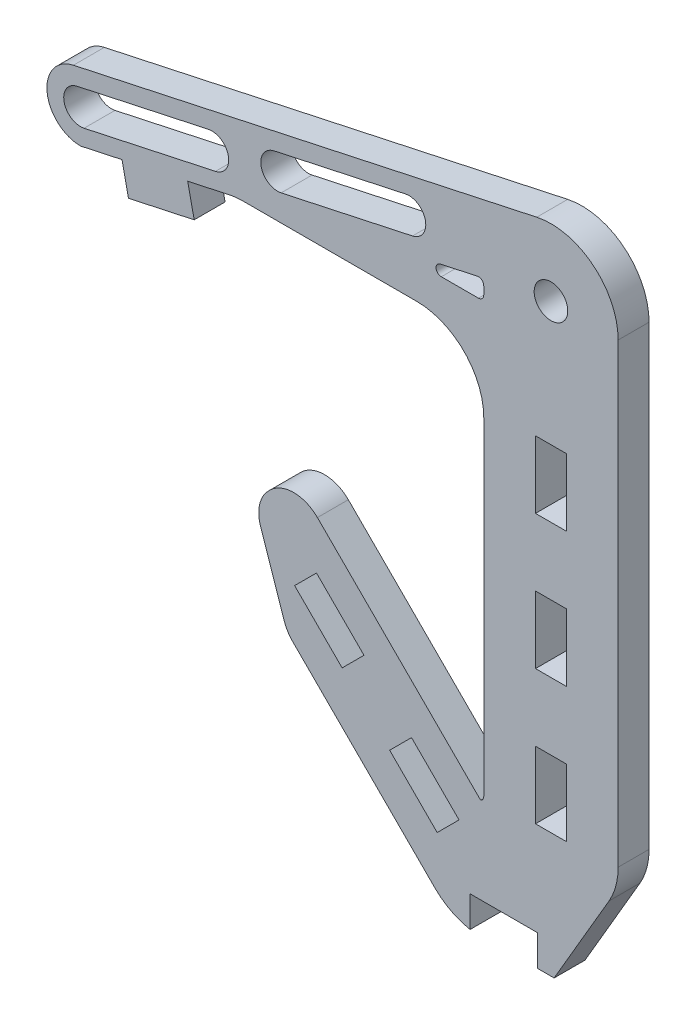
from build123d import *

# Parameters (mm, degrees)
SKETCH1_R           = 3.175
SKETCH1_W           = 5.842
SKETCH1_H           = 12.7
BOSS_EXTRUDE1_DEPTH = 5.842
FILLET3_R           = 12.7
FILLET4_R           = 1
FILLET5_R           = 1
BOSS_EXTRUDE2_DEPTH = 5.842
CUT_EXTRUDE1_DEPTH  = 282.950775489
FILLET6_R           = 6.35
BOSS_EXTRUDE3_DEPTH = 5.842


with BuildPart() as part:
    # Sketch1 → Boss-Extrude1 (new body)
    with BuildSketch(Plane.XY):
        with BuildLine():
            Line((217.770203729, 9.126532246), (220.945203729, 9.126532246))
            Line((220.945203729, 9.126532246), (220.945203729, 14.968532246))
            Line((220.945203729, 14.968532246), (233.645203729, 14.968532246))
            Line((233.645203729, 14.968532246), (233.645203729, 9.126532246))
            Line((233.645203729, 9.126532246), (236.820203729, 9.126532246))
            Line((236.820203729, 9.126532246), (248.922907622, 29.883396652))
            Line((248.922907622, 29.883396652), (248.922907622, 36.233396652))
            Line((248.922907622, 36.233396652), (248.922907622, 99.733396652))
            Line((248.922907622, 99.733396652), (248.922907622, 119.585663985))
            ThreePointArc((248.922907622, 119.585663985), (244.199339956, 129.46830165), (233.542352153, 131.99955227))
            Line((233.542352153, 131.99955227), (145.982629888, 113.092608128))
            ThreePointArc((145.982629888, 113.092608128), (141.008772871, 106.211718626), (147.322907622, 100.535663985))
            Line((147.322907622, 100.535663985), (176.730316466, 106.885663985))
            Line((176.730316466, 106.885663985), (223.522907622, 106.885663985))
            Line((223.522907622, 106.885663985), (223.522907622, 30.685663985))
            Line((223.522907622, 30.685663985), (222.929875834, 31.278695773))
            Line((222.929875834, 31.278695773), (218.798958018, 27.147777957))
            Line((218.798958018, 27.147777957), (209.818701897, 36.128034078))
            Line((209.818701897, 36.128034078), (213.949619713, 40.258951894))
            Line((213.949619713, 40.258951894), (204.969363592, 49.239208015))
            Line((204.969363592, 49.239208015), (200.838445776, 45.108290199))
            Line((200.838445776, 45.108290199), (187.961093383, 57.985642593))
            Line((187.961093383, 57.985642593), (192.092011199, 62.116560408))
            Line((192.092011199, 62.116560408), (187.601883138, 66.606688469))
            Line((187.601883138, 66.606688469), (180.072011297, 59.076816628))
            Line((180.072011297, 59.076816628), (186.339307306, 40.55742867))
            Line((186.339307306, 40.55742867), (190.829435366, 36.067300609))
            Line((190.829435366, 36.067300609), (217.770203729, 9.126532246))
        make_face()
        with Locations((236.222907622, 119.585663985)):
            Circle(SKETCH1_R, mode=Mode.SUBTRACT)
        Polygon((223.522907622, 116.989680814), (223.522907622, 113.235663985), (206.137725309, 113.235663985), align=None, mode=Mode.SUBTRACT)
        with BuildLine():
            Line((146.652768755, 109.989136056), (171.480545327, 115.350246995))
            ThreePointArc((171.480545327, 115.350246995), (175.254156266, 112.916913791), (172.820823062, 109.143302852))
            Line((172.820823062, 109.143302852), (147.99304649, 103.782191913))
            ThreePointArc((147.99304649, 103.782191913), (144.219435551, 106.215525117), (146.652768755, 109.989136056))
        make_face(mode=Mode.SUBTRACT)
        with BuildLine():
            Line((183.894433613, 118.030802464), (208.722210185, 123.391913403))
            ThreePointArc((208.722210185, 123.391913403), (212.495821124, 120.958580199), (210.062487919, 117.18496926))
            Line((210.062487919, 117.18496926), (185.234711348, 111.823858321))
            ThreePointArc((185.234711348, 111.823858321), (181.461100409, 114.257191525), (183.894433613, 118.030802464))
        make_face(mode=Mode.SUBTRACT)
        with Locations((236.222907622, 38.956098115)):
            Rectangle(SKETCH1_W, SKETCH1_H, mode=Mode.SUBTRACT)
        with Locations((236.222907622, 64.356098115)):
            Rectangle(SKETCH1_W, SKETCH1_H, mode=Mode.SUBTRACT)
        with Locations((236.222907622, 89.756098115)):
            Rectangle(SKETCH1_W, SKETCH1_H, mode=Mode.SUBTRACT)
    extrude(amount=BOSS_EXTRUDE1_DEPTH)

    # Fillet3
    # the kernel refuses this fillet: 12.7 mm, written as the material it adds along each edge
    with BuildSketch(Plane(origin=(223.522907622, 106.885663985, 0), x_dir=(0, -1, 0), z_dir=(0, 0, 1))) as fillet3_piece_1:
        with BuildLine():
            CenterArc((FILLET3_R, -FILLET3_R), FILLET3_R, 90, 90)
            Line((0, -FILLET3_R), (0, 0))
            Line((0, 0), (FILLET3_R, 0))
        make_face()
    extrude(amount=5.842)
    with BuildSketch(Plane(origin=(176.730316466, 106.885663985, 0), x_dir=(1, 0, 0), z_dir=(0, 0, 1))) as fillet3_piece_2:
        with BuildLine():
            CenterArc((FILLET3_R * 0.106735979666, -FILLET3_R), FILLET3_R, 90, 12.184909582)
            Line((-FILLET3_R * 0.104331380131, -FILLET3_R * 0.0225284814234), (0, 0))
            Line((0, 0), (FILLET3_R * 0.106735979666, 0))
        make_face()
    extrude(amount=5.842)
    # the kernel refuses this fillet: 12.7 mm, written as the material it takes off along each edge
    with BuildSketch(Plane(origin=(248.922907622, 29.883396652, -8.580237273), x_dir=(-0.50370125175659, -0.8638779132370756, 0), z_dir=(0, 0, 1))) as fillet3_2_piece_1:
        with BuildLine():
            CenterArc((FILLET3_R * 0.270243693634, -FILLET3_R), FILLET3_R, 90, 30.245176455)
            Line((-FILLET3_R * 0.233457558122, -FILLET3_R * 0.136122086763), (0, 0))
            Line((0, 0), (FILLET3_R * 0.270243693634, 0))
        make_face()
    extrude(amount=23.002474546, mode=Mode.SUBTRACT)
    with BuildSketch(Plane(origin=(217.770203729, 9.126532246, -12.412377003), x_dir=(1, 0, 0), z_dir=(0, 0, 1))) as fillet3_2_piece_2:
        with BuildLine():
            CenterArc((5.469505741, 12.491006501), FILLET3_R, 225, 34.591227114)
            Line((-3.51075038, 3.51075038), (0, 0))
            Line((0, 0), (3.175, 0))
        make_face()
    extrude(amount=30.666754006, mode=Mode.SUBTRACT)

    # Fillet4
    fillet4_edges = [part.edges().sort_by_distance(p)[0] for p in [
        (223.522907622, 116.989680814, 2.921),
        (206.137725309, 113.235663985, 2.921),
        (223.522907622, 113.235663985, 2.921),
    ]]
    fillet(fillet4_edges, radius=FILLET4_R)

    # Fillet5
    # the kernel refuses this fillet: 1 mm, written as the material it adds along each edge
    with BuildSketch(Plane(origin=(223.522907622, 30.685663985, 0), x_dir=(0, 1, 0), z_dir=(0, 0, 1))) as fillet5_piece_1:
        with BuildLine():
            CenterArc((1.50647411, 1), FILLET5_R, 204.01452435, 65.98547565)
            Line((0.593031788, 0.593031788), (0.574762942, 0.584892424))
            ThreePointArc((0.574762942, 0.584892424), (0.282373759, 0.31065803), (-0.014142136, 0.014142136))
            Line((-0.014142136, 0.014142136), (0, -0.02))
            Line((0, -0.02), (1.50647411, -0.02))
            Line((1.50647411, -0.02), (1.50647411, 0))
        make_face()
    extrude(amount=5.842)

    # Sketch4 → Boss-Extrude2 (add)
    with BuildSketch(Plane.XY.offset(5.842)):
        Polygon((192.092011199, 62.116560408), (222.590849502, 31.617722105), (222.929875834, 31.278695773), (218.798958018, 27.147777957), (187.961093383, 57.985642593), align=None)
    extrude(amount=-BOSS_EXTRUDE2_DEPTH)

    # Sketch5 → Cut-Extrude1 (cut, through all)
    with BuildSketch(Plane.XY.offset(5.842)):
        Polygon((191.912406076, 52.956699165), (187.781488261, 48.825781349), (196.761744382, 39.845525228), (200.892662197, 43.976443044), align=None)
        Polygon((209.872918318, 34.996186923), (205.742000503, 30.865269107), (214.722256624, 21.885012986), (218.85317444, 26.015930802), align=None)
    extrude(amount=-CUT_EXTRUDE1_DEPTH, mode=Mode.SUBTRACT)

    # Fillet6
    fillet6_edges = [part.edges().sort_by_distance(p)[0] for p in [
        (186.339307306, 40.55742867, 2.921),
        (180.072011297, 59.076816628, 2.921),
        (187.601883138, 66.606688469, 2.921),
    ]]
    fillet(fillet6_edges, radius=FILLET6_R)

    # Sketch6 → Boss-Extrude3 (add)
    with BuildSketch(Plane.XY.offset(5.842)):
        Polygon((168.804107439, 99.197497251), (156.390219153, 96.516941781), (155.157163637, 102.227330393), (167.571051923, 104.907885862), align=None)
    extrude(amount=-BOSS_EXTRUDE3_DEPTH)


solid = part.part
